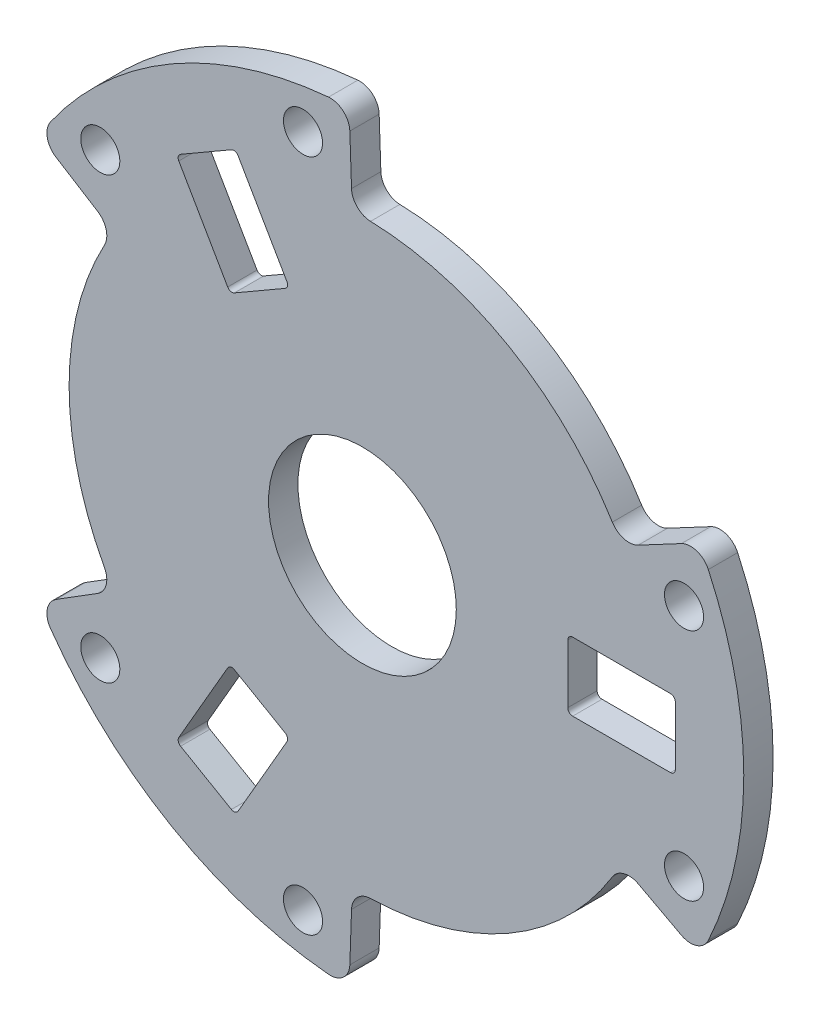
from build123d import *

# Parameters (mm, degrees)
SKETCH1_R           = 2
SKETCH1_R_2         = 9.6
BOSS_EXTRUDE1_DEPTH = 3


with BuildPart() as part:
    # Sketch1 → Boss-Extrude1 (new body)
    with BuildSketch(Plane.XY):
        with BuildLine():
            Line((-34.695872058, 19.578347538), (-30.44845068, 16.924264094))
            ThreePointArc((-30.44845068, 16.924264094), (-29.574568094, 15.738777979), (-29.749269037, 14.276407408))
            ThreePointArc((-29.749269037, 14.276407408), (-33.363966471, 0), (-29.749269037, -14.276407408))
            ThreePointArc((-29.749269037, -14.276407408), (-29.574568094, -15.738777979), (-30.44845068, -16.924264094))
            Line((-30.44845068, -16.924264094), (-34.695872058, -19.578347538))
            ThreePointArc((-34.695872058, -19.578347538), (-35.596225232, -20.877394003), (-35.272361478, -22.424413662))
            ThreePointArc((-35.272361478, -22.424413662), (-22.863966471, -33.774990748), (-6.829880863, -38.845687501))
            ThreePointArc((-6.829880863, -38.845687501), (-5.328190661, -38.35265191), (-4.65336001, -36.923399956))
            Line((-4.65336001, -36.923399956), (-4.478567013, -31.917983421))
            ThreePointArc((-4.478567013, -31.917983421), (-3.888847214, -30.568435843), (-2.535046678, -29.988546013))
            ThreePointArc((-2.535046678, -29.988546013), (11.636033529, -25.980762114), (22.192416302, -15.712138605))
            ThreePointArc((22.192416302, -15.712138605), (23.371515894, -14.829657864), (24.83511828, -14.993719326))
            Line((24.83511828, -14.993719326), (29.257332654, -17.345052418))
            ThreePointArc((29.257332654, -17.345052418), (30.832516481, -17.475257907), (32.010342929, -16.421273839))
            ThreePointArc((32.010342929, -16.421273839), (35.636033529, 0), (32.010342929, 16.421273839))
            ThreePointArc((32.010342929, 16.421273839), (30.832516481, 17.475257907), (29.257332654, 17.345052418))
            Line((29.257332654, 17.345052418), (24.83511828, 14.993719326))
            ThreePointArc((24.83511828, 14.993719326), (23.371515894, 14.829657864), (22.192416302, 15.712138605))
            ThreePointArc((22.192416302, 15.712138605), (11.636033529, 25.980762114), (-2.535046678, 29.988546013))
            ThreePointArc((-2.535046678, 29.988546013), (-3.888847214, 30.568435843), (-4.478567013, 31.917983421))
            Line((-4.478567013, 31.917983421), (-4.65336001, 36.923399956))
            ThreePointArc((-4.65336001, 36.923399956), (-5.328190661, 38.35265191), (-6.829880863, 38.845687501))
            ThreePointArc((-6.829880863, 38.845687501), (-22.863966471, 33.774990748), (-35.272361478, 22.424413662))
            ThreePointArc((-35.272361478, 22.424413662), (-35.596225232, 20.877394003), (-34.695872058, 19.578347538))
        make_face()
        with Locations((-30.17552198, -22.497566339)):
            Circle(SKETCH1_R, mode=Mode.SUBTRACT)
        with Locations((-9.441652689, -34.468271355)):
            Circle(SKETCH1_R, mode=Mode.SUBTRACT)
        with BuildLine():
            Line((-11.082877558, -20.369546181), (-16.082877558, -29.029800219))
            ThreePointArc((-16.082877558, -29.029800219), (-16.386480737, -29.262763132), (-16.76589026, -29.212812921))
            Line((-16.76589026, -29.212812921), (-21.962042682, -26.212812921))
            ThreePointArc((-21.962042682, -26.212812921), (-22.195005595, -25.909209742), (-22.145055384, -25.529800219))
            Line((-22.145055384, -25.529800219), (-17.145055384, -16.869546181))
            ThreePointArc((-17.145055384, -16.869546181), (-16.841452205, -16.636583268), (-16.462042682, -16.686533479))
            Line((-16.462042682, -16.686533479), (-11.26589026, -19.686533479))
            ThreePointArc((-11.26589026, -19.686533479), (-11.032927346, -19.990136659), (-11.082877558, -20.369546181))
        make_face(mode=Mode.SUBTRACT)
        with Locations((29.525275257, -11.970705016)):
            Circle(SKETCH1_R, mode=Mode.SUBTRACT)
        with BuildLine():
            Line((18.136033529, 3.5), (28.136033529, 3.5))
            ThreePointArc((28.136033529, 3.5), (28.48958692, 3.353553391), (28.636033529, 3))
            Line((28.636033529, 3), (28.636033529, -3))
            ThreePointArc((28.636033529, -3), (28.48958692, -3.353553391), (28.136033529, -3.5))
            Line((28.136033529, -3.5), (18.136033529, -3.5))
            ThreePointArc((18.136033529, -3.5), (17.782480138, -3.353553391), (17.636033529, -3))
            Line((17.636033529, -3), (17.636033529, 3))
            ThreePointArc((17.636033529, 3), (17.782480138, 3.353553391), (18.136033529, 3.5))
        make_face(mode=Mode.SUBTRACT)
        with Locations((-3.363966471, 0)):
            Circle(SKETCH1_R_2, mode=Mode.SUBTRACT)
        with Locations((-30.17552198, 22.497566339)):
            Circle(SKETCH1_R, mode=Mode.SUBTRACT)
        with BuildLine():
            Line((-17.145055384, 16.869546181), (-22.145055384, 25.529800219))
            ThreePointArc((-22.145055384, 25.529800219), (-22.195005595, 25.909209742), (-21.962042682, 26.212812921))
            Line((-21.962042682, 26.212812921), (-16.76589026, 29.212812921))
            ThreePointArc((-16.76589026, 29.212812921), (-16.386480737, 29.262763132), (-16.082877558, 29.029800219))
            Line((-16.082877558, 29.029800219), (-11.082877558, 20.369546181))
            ThreePointArc((-11.082877558, 20.369546181), (-11.032927346, 19.990136659), (-11.26589026, 19.686533479))
            Line((-11.26589026, 19.686533479), (-16.462042682, 16.686533479))
            ThreePointArc((-16.462042682, 16.686533479), (-16.841452205, 16.636583268), (-17.145055384, 16.869546181))
        make_face(mode=Mode.SUBTRACT)
        with Locations((-9.441652689, 34.468271355)):
            Circle(SKETCH1_R, mode=Mode.SUBTRACT)
        with Locations((29.525275257, 11.970705016)):
            Circle(SKETCH1_R, mode=Mode.SUBTRACT)
    extrude(amount=BOSS_EXTRUDE1_DEPTH)


solid = part.part
